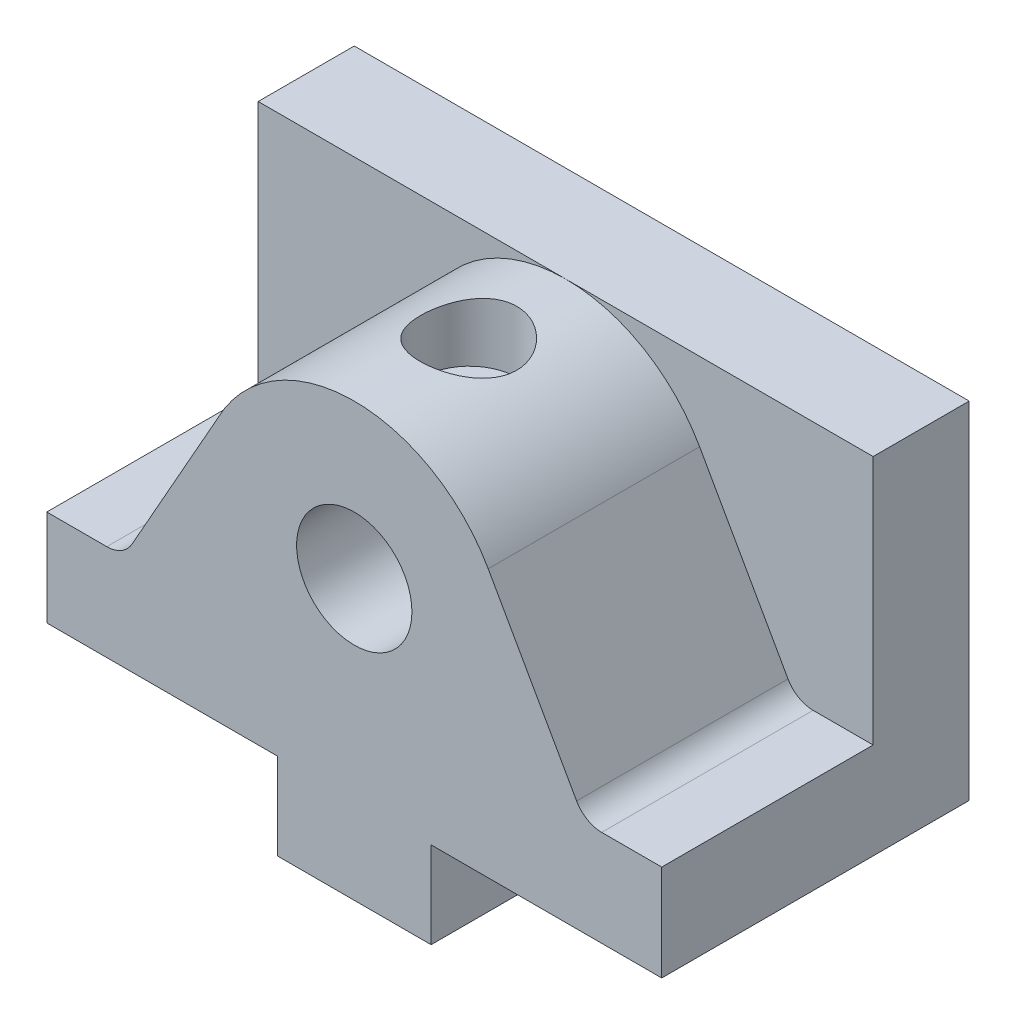
from build123d import *

# Parameters (mm, degrees)
BOSS_EXTRUDE1_DEPTH       = 36
CUT_EXTRUDE6_DEPTH        = 22
SKETCH11_R                = 6.000000000000001
CUT_EXTRUDE7_DEPTH        = 58.827329183593626
SKETCH12_W                = 16
SKETCH12_H                = 32
BOSS_EXTRUDE2_DEPTH       = 9
F_1_0MM_DOWEL_HOLE1_D     = 6
F_1_0MM_DOWEL_HOLE1_DEPTH = 16
F_1_0MM_DOWEL_HOLE1_TIP   = 1.8025818570826808


# Read off the part's stored shape, not the designer's step: CBORE for M6 Hex Socket Head Cap Screw2
with BuildPart() as part:
    # Sketch1 → Boss-Extrude1 (new body)
    with BuildSketch(Plane(origin=(0, 0, 0), x_dir=(1, 0, 0), z_dir=(0, 1, 0))):
        Polygon((-32.000000000000014, 16), (32, 16), (32, -16), (-32.00000000000001, -16), align=None)
    extrude(amount=BOSS_EXTRUDE1_DEPTH)

    # Sketch2 → Cut-Extrude6 (cut)
    with BuildSketch(Plane.XY.offset(16)):
        with BuildLine():
            Line((0.00047501965244123, 36), (-32.00000000000001, 36))
            Line((-32.00000000000001, 36), (-32.00000000000001, 10))
            Line((-32.00000000000001, 10), (-25.751640415984067, 10))
            ThreePointArc((-25.751640415984067, 10), (-24.238970505556754, 10.409280072626942), (-23.139037695662964, 11.5254468386081))
            Line((-23.139037695662964, 11.5254468386081), (-14.249494850462119, 27.275875122834456))
            ThreePointArc((-14.249494850462119, 27.275875122834453), (-8.35374541517065, 33.645768615897694), (0.00047501965243812, 36.00000000705136))
        make_face()
        with BuildLine():
            Line((31.999999999999993, 36), (0.00047501965244123, 36))
            ThreePointArc((0.00047501965243812, 36.00000000705136), (8.07302482579058, 33.814265808302636), (13.940018609128462, 27.85424246049306))
            Line((13.940018609128462, 27.85424246049306), (23.139425445581196, 11.527329539979691))
            ThreePointArc((23.139425445581196, 11.527329539979691), (24.239486779956046, 10.409825162265975), (25.753089868605628, 10))
            Line((25.753089868605628, 10), (32, 10.000000000000002))
            Line((32, 10.000000000000002), (32, 36))
        make_face()
    extrude(amount=-CUT_EXTRUDE6_DEPTH, mode=Mode.SUBTRACT)

    # Sketch11 → Cut-Extrude7 (cut, through all)
    with BuildSketch(Plane.XY.offset(16)):
        with Locations((0.00047501966492051, 20.000000007051366)):
            Circle(SKETCH11_R)
    extrude(amount=-CUT_EXTRUDE7_DEPTH, mode=Mode.SUBTRACT)

    # Sketch12 → Boss-Extrude2 (add)
    with BuildSketch(Plane.XZ):
        Rectangle(SKETCH12_W, SKETCH12_H)
    extrude(amount=BOSS_EXTRUDE2_DEPTH)

    # CBORE for M6 Hex Socket Head Cap Scr 2 → CBORE for M6 Hex Socket Head Cap Screw2 (revolve, cut)
    with BuildSketch(Plane(origin=(0.121141314, 0.00073091, 3.999999998), x_dir=(0.9999817987234716, 0.006033425376210058, 0), z_dir=(0, 0, -1))):
        Polygon((3, -29.599633116), (3, -25.195487191), (0, -25.195487191), (0, -35.999736435), (5, -35.999736435), (5, -29.599633116), align=None)
    revolve(axis=Axis((0.121141314, 0.00073091, 3.999999998), (0.006033425376210058, -0.9999817987234716, 0)), mode=Mode.SUBTRACT)

    # Ø1.0mm Dowel Hole1
    with Locations(Plane(origin=(0, -9, 0), x_dir=(-1, 0, 0), z_dir=(0, -1, 0))):
        with Locations((0, 8), (0, -8)):
            Hole(F_1_0MM_DOWEL_HOLE1_D / 2, depth=F_1_0MM_DOWEL_HOLE1_DEPTH)
            with Locations((0, 0, -(F_1_0MM_DOWEL_HOLE1_DEPTH + F_1_0MM_DOWEL_HOLE1_TIP / 2))):  # 118° drill point
                Cone(0, F_1_0MM_DOWEL_HOLE1_D / 2, F_1_0MM_DOWEL_HOLE1_TIP, mode=Mode.SUBTRACT)


solid = part.part
